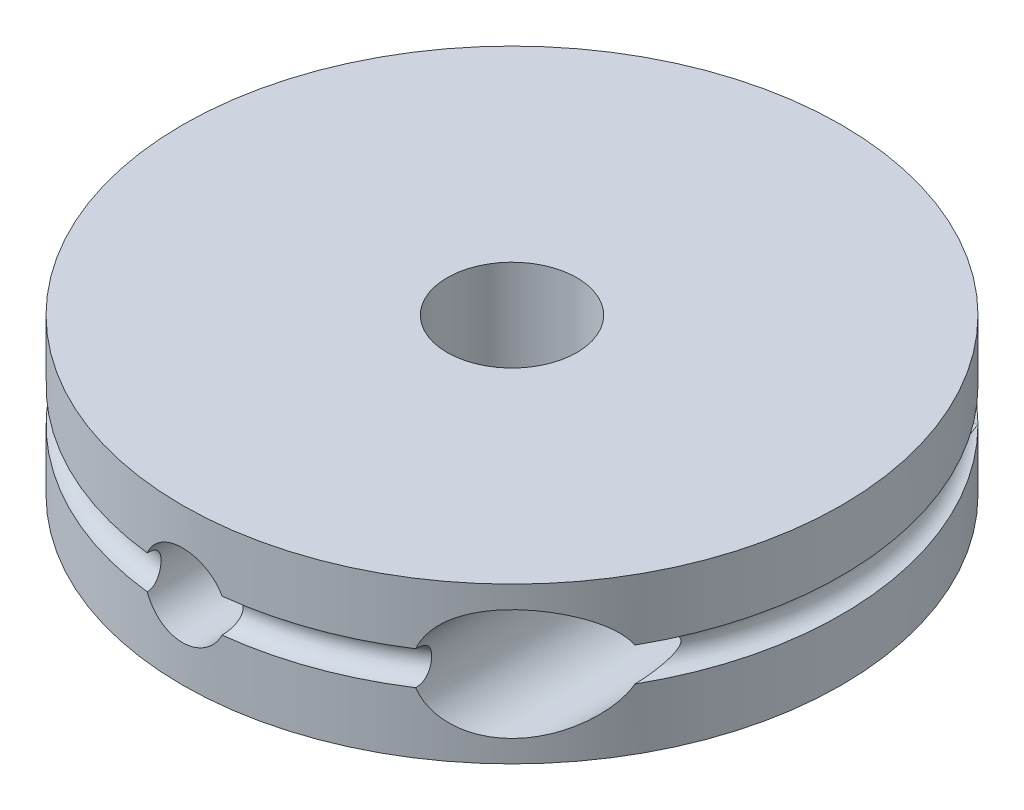
from build123d import *

# Parameters (mm, degrees)
BASE_R                  = 12.7
BASE_R_2                = 2.5
MAIN_BODY_DEPTH         = 6
SKETCH4_R               = 0.65
CUT_EXTRUDE2_REACH      = 20.936
SKETCH5_R               = 1.58115
CUT_EXTRUDE3_DEPTH      = 19.936208869
CUT_EXTRUDE3_DEPTH_BACK = 19.936208869
SKETCH8_R               = 0.65
SKETCH9_R               = 2.15
CUT_EXTRUDE4_DEPTH      = 19.936208869


with BuildPart() as part:
    # BASE → MAIN_BODY (new body)
    with BuildSketch(Plane(origin=(0, 0, 0), x_dir=(1, 0, 0), z_dir=(0, 1, 0))):
        Circle(BASE_R)
        Circle(BASE_R_2, mode=Mode.SUBTRACT)
    extrude(amount=MAIN_BODY_DEPTH)

    # Sketch4 → CABLE_GUIDE (revolve, cut)
    with BuildSketch(Plane.XY):
        with Locations((12.7, 3)):
            Circle(SKETCH4_R)
    revolve(axis=Axis((0, 0, 0), (0, 1, 0)), mode=Mode.SUBTRACT)

    # Sketch5 → Cut-Extrude2 (cut, up to next)
    with BuildSketch(Plane.XY, mode=Mode.PRIVATE) as cut_extrude2_sk1:
        with Locations((0, 3)):
            Circle(SKETCH5_R)
    cut_extrude2_tool1 = extrude(cut_extrude2_sk1.sketch, amount=CUT_EXTRUDE2_REACH, mode=Mode.PRIVATE) & part.part
    add(cut_extrude2_tool1.solids().sort_by_distance((0, 3, 0))[0], mode=Mode.SUBTRACT)

    # Sketch8 → Cut-Extrude3 (cut, two sides: drawn at the far end of the back side and taken through both)
    with BuildSketch(Plane.XY.offset(-CUT_EXTRUDE3_DEPTH_BACK)):
        with Locations((8.98025612, 3)):
            Circle(SKETCH8_R)
    extrude(amount=CUT_EXTRUDE3_DEPTH + CUT_EXTRUDE3_DEPTH_BACK, mode=Mode.SUBTRACT)

    # Sketch9 → Cut-Extrude4 (cut, through all)
    with BuildSketch(Plane.XY):
        with Locations((8.98025612, 3)):
            Circle(SKETCH9_R)
    extrude(amount=CUT_EXTRUDE4_DEPTH, mode=Mode.SUBTRACT)


solid = part.part
